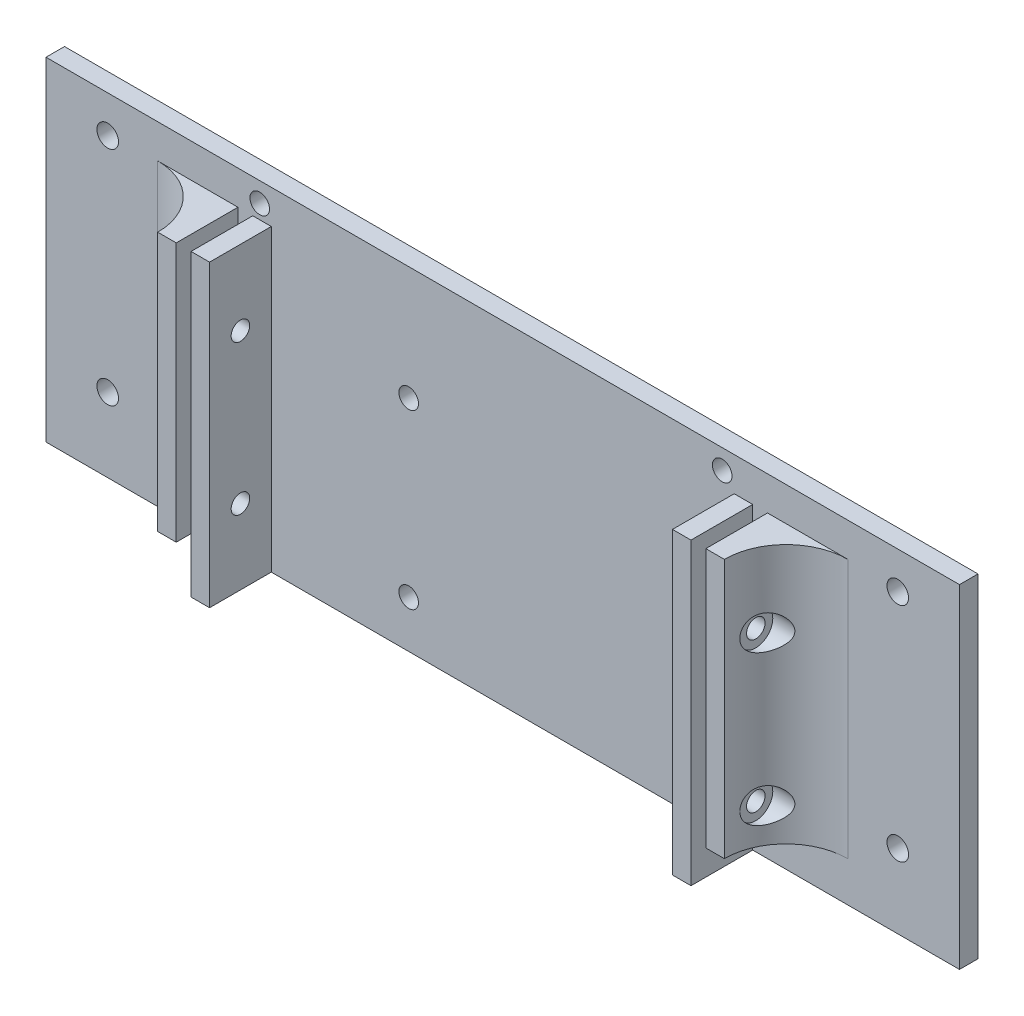
from build123d import *

# Parameters (mm, degrees)
BOSS_EXTRUDE1_DEPTH     = 54
SKETCH2_W               = 10
SKETCH2_H               = 5.5
CUT_EXTRUDE1_DEPTH      = 85
SKETCH5_R               = 1.5875
CUT_EXTRUDE4_DEPTH      = 85
SKETCH3_R               = 1.5875
CUT_EXTRUDE5_DEPTH      = 10
SKETCH6_W               = 18.5
SKETCH6_H               = 54
BOSS_EXTRUDE2_DEPTH     = 3
SKETCH7_W               = 3
SKETCH7_H               = 42
BOSS_EXTRUDE3_DEPTH     = 10
CUT_EXTRUDE3_DEPTH      = 127.989172767
CUT_EXTRUDE3_DEPTH_BACK = 127.989172767
SKETCH4_R               = 1.5
FILLET1_R               = 10
SKETCH8_R               = 2.75
CUT_EXTRUDE6_DEPTH      = 28
CUT_EXTRUDE7_START      = -28
SKETCH10_R              = 2.75
CUT_EXTRUDE7_DEPTH      = 28
SKETCH11_R              = 1.75
CUT_EXTRUDE8_DEPTH      = 4.3


with BuildPart() as part:
    # Sketch1 → Boss-Extrude1 (new body)
    with BuildSketch(Plane(origin=(0, 0, 0), x_dir=(1, 0, 0), z_dir=(0, 1, 0))):
        Polygon((-37.5, -10), (-37.5, 0), (37.5, 0), (37.5, -10), (40.5, -10), (40.5, 0), (55.5, 0), (55.5, 3), (-55.5, 3), (-55.5, 0), (-40.5, 0), (-40.5, -10), align=None)
    extrude(amount=BOSS_EXTRUDE1_DEPTH)

    # Sketch2 → Cut-Extrude1 (cut)
    with BuildSketch(Plane.ZY.offset(40.5)):
        with Locations((5, 51.25)):
            Rectangle(SKETCH2_W, SKETCH2_H)
    extrude(amount=-CUT_EXTRUDE1_DEPTH, mode=Mode.SUBTRACT)

    # Sketch5 → Cut-Extrude4 (cut)
    with BuildSketch(Plane(origin=(0, 0, -3), x_dir=(-1, 0, 0), z_dir=(0, 0, -1))):
        with Locations((15.24, 35.56)):
            Circle(SKETCH5_R)
        with Locations((15.24, 7.62)):
            Circle(SKETCH5_R)
    extrude(amount=-CUT_EXTRUDE4_DEPTH, mode=Mode.SUBTRACT)

    # Sketch3 → Cut-Extrude5 (cut)
    with BuildSketch(Plane(origin=(0, 0, -3), x_dir=(-1, 0, 0), z_dir=(0, 0, -1))):
        with Locations((45.72, 2.54)):
            Circle(SKETCH3_R)
        with Locations((-35.56, 50.8)):
            Circle(SKETCH3_R)
        with Locations((39.37, 50.8)):
            Circle(SKETCH3_R)
    extrude(amount=-CUT_EXTRUDE5_DEPTH, mode=Mode.SUBTRACT)

    # Sketch6 → Boss-Extrude2 (add)
    with BuildSketch(Plane(origin=(0, 0, -3), x_dir=(-1, 0, 0), z_dir=(0, 0, -1))):
        with Locations((-64.75, 27)):
            Rectangle(SKETCH6_W, SKETCH6_H)
        with Locations((64.75, 27)):
            Rectangle(SKETCH6_W, SKETCH6_H)
    extrude(amount=-BOSS_EXTRUDE2_DEPTH)

    # Sketch7 → Boss-Extrude3 (add)
    with BuildSketch(Plane.XY):
        with Locations((-44.4, 27.5)):
            Rectangle(SKETCH7_W, SKETCH7_H)
        with Locations((44.4, 27.5)):
            Rectangle(SKETCH7_W, SKETCH7_H)
    extrude(amount=BOSS_EXTRUDE3_DEPTH)

    # Sketch4 → Cut-Extrude3 (cut, two sides: drawn at the far end of the back side and taken through both)
    with BuildSketch(Plane.ZY.offset(40.5).offset(-CUT_EXTRUDE3_DEPTH_BACK)):
        with Locations((5, 12.125)):
            Circle(SKETCH4_R)
        with Locations((5, 36.375)):
            Circle(SKETCH4_R)
    extrude(amount=CUT_EXTRUDE3_DEPTH + CUT_EXTRUDE3_DEPTH_BACK, mode=Mode.SUBTRACT)

    # Fillet1
    # the kernel refuses this fillet: 10 mm, written as the material it adds along each edge
    with BuildSketch(Plane(origin=(45.9, 48.5, 0), x_dir=(1, 0, 0), z_dir=(0, -1, 0))) as fillet1_piece_1_section:
        with BuildLine():
            CenterArc((FILLET1_R, FILLET1_R), FILLET1_R, 180, 90)
            Line((0, FILLET1_R), (0, 0))
            Line((0, 0), (FILLET1_R, 0))
        make_face()
    fillet1_piece_1 = extrude(amount=42, mode=Mode.PRIVATE)
    fillet1_piece_1 = fillet1_piece_1 - Plane(origin=(48.198345869, 36.375, 5), x_dir=(0, 0, 1), z_dir=(-1, 0, 0)) * Cylinder(1.5, 124, mode=Mode.PRIVATE)
    fillet1_piece_1 = fillet1_piece_1 - Plane(origin=(48.198345869, 12.125, 5), x_dir=(0, 0, 1), z_dir=(-1, 0, 0)) * Cylinder(1.5, 124, mode=Mode.PRIVATE)
    add(fillet1_piece_1)
    with BuildSketch(Plane(origin=(-45.9, 48.5, 0), x_dir=(-1, 0, 0), z_dir=(0, -1, 0))) as fillet1_piece_2_section:
        with BuildLine():
            CenterArc((FILLET1_R, -FILLET1_R), FILLET1_R, 90, 90)
            Line((0, -FILLET1_R), (0, 0))
            Line((0, 0), (FILLET1_R, 0))
        make_face()
    fillet1_piece_2 = extrude(amount=42, mode=Mode.PRIVATE)
    fillet1_piece_2 = fillet1_piece_2 - Plane(origin=(-48.198347973, 36.375, 5), x_dir=(0, 0, 1), z_dir=(1, 0, 0)) * Cylinder(1.5, 124, mode=Mode.PRIVATE)
    fillet1_piece_2 = fillet1_piece_2 - Plane(origin=(-48.198347973, 12.125, 5), x_dir=(0, 0, 1), z_dir=(1, 0, 0)) * Cylinder(1.5, 124, mode=Mode.PRIVATE)
    add(fillet1_piece_2)

    # Sketch8 → Cut-Extrude6 (cut)
    with BuildSketch(Plane(origin=(74, 0, 0), x_dir=(0, 0, -1), z_dir=(1, 0, 0))):
        with Locations((-5, 36.375)):
            Circle(SKETCH8_R)
        with Locations((-5, 12.125)):
            Circle(SKETCH8_R)
    extrude(amount=-CUT_EXTRUDE6_DEPTH, mode=Mode.SUBTRACT)

    # Sketch10 → Cut-Extrude7 (cut)
    with BuildSketch(Plane.ZY.offset(74).offset(CUT_EXTRUDE7_START)):
        with Locations(Location((5, 12.125, 0), (0, 0, 180))):
            Circle(SKETCH10_R)
        with Locations(Location((5, 36.375, 0), (0, 0, 180))):
            Circle(SKETCH10_R)
    extrude(amount=CUT_EXTRUDE7_DEPTH, mode=Mode.SUBTRACT)

    # Sketch11 → Cut-Extrude8 (cut)
    with BuildSketch(Plane(origin=(0, 0, -3), x_dir=(-1, 0, 0), z_dir=(0, 0, -1))):
        with Locations((64, 12)):
            Circle(SKETCH11_R)
        with Locations((64, 48)):
            Circle(SKETCH11_R)
        with Locations((-64, 48)):
            Circle(SKETCH11_R)
        with Locations((-64, 12)):
            Circle(SKETCH11_R)
    extrude(amount=-CUT_EXTRUDE8_DEPTH, mode=Mode.SUBTRACT)


solid = part.part
